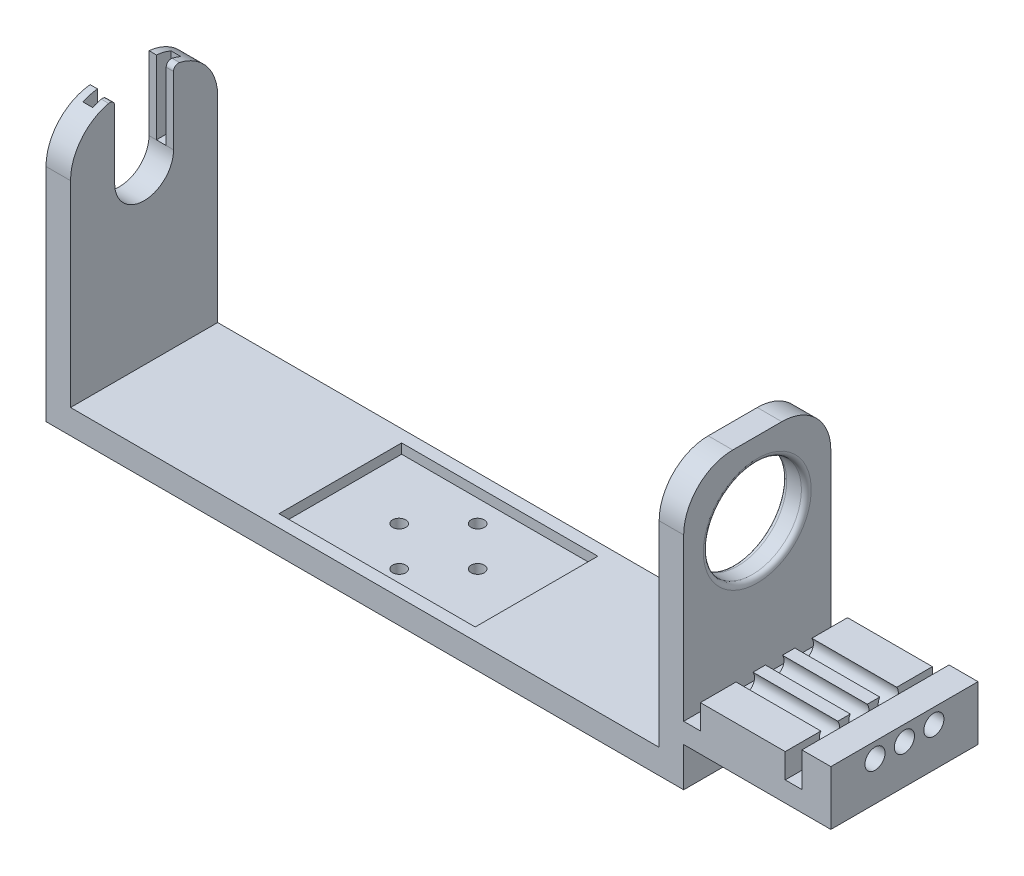
from build123d import *

# Parameters (mm, degrees)
SKETCH1_W           = 130
SKETCH1_H           = 30
BOSS_EXTRUDE1_DEPTH = 5
BOSS_EXTRUDE3_DEPTH = 1.8
SKETCH6_W           = 40
SKETCH6_H           = 25
CUT_EXTRUDE2_DEPTH  = 2
SKETCH5_R           = 1.35
CUT_EXTRUDE3_DEPTH  = 6
SKETCH8_W           = 5
SKETCH8_H           = 30
BOSS_EXTRUDE4_DEPTH = 50
SKETCH9_R           = 10
CUT_EXTRUDE4_DEPTH  = 5
SKETCH10_W          = 30
SKETCH10_H          = 11.1
BOSS_EXTRUDE5_DEPTH = 30
SKETCH11_W          = 3.4
SKETCH11_H          = 30
CUT_EXTRUDE5_DEPTH  = 7
CUT_EXTRUDE6_REACH  = 173.828
SKETCH12_R          = 2.05
CUT_EXTRUDE7_DEPTH  = 5
SKETCH14_W          = 17.3
SKETCH14_H          = 30
CUT_EXTRUDE8_DEPTH  = 2
SKETCH15_W          = 2
SKETCH15_H          = 3
CUT_EXTRUDE9_DEPTH  = 15
FILLET1_START       = -1
FILLET1_DEPTH       = 161
FILLET1_START_2     = 5
FILLET1_2_DEPTH     = 155
FILLET3_R           = 1
FILLET6_R           = 1


with BuildPart() as part:
    # Sketch1 → Boss-Extrude1 (new body)
    with BuildSketch(Plane(origin=(0, 0, 0), x_dir=(1, 0, 0), z_dir=(0, 1, 0))):
        with Locations((65, -15)):
            Rectangle(SKETCH1_W, SKETCH1_H)
    extrude(amount=BOSS_EXTRUDE1_DEPTH)

    # Sketch4 → Boss-Extrude3 (add)
    with BuildSketch(Plane.XZ):
        Polygon((63.1, 25), (66.9, 25), (66.9, 17), (66.9, 16.95), (67.95, 16.95), (74.95, 16.95), (74.95, 13.15), (66.95, 13.15), (66.9, 13.15), (66.9, 12.1), (66.9, 5.1), (63.1, 5.1), (63.1, 13.1), (63.1, 13.15), (62.05, 13.15), (55.05, 13.15), (55.05, 16.95), (63.05, 16.95), (63.1, 16.95), (63.1, 18), align=None)
    extrude(amount=BOSS_EXTRUDE3_DEPTH)

    # Sketch6 → Cut-Extrude2 (cut)
    with BuildSketch(Plane(origin=(0, 5, 0), x_dir=(1, 0, 0), z_dir=(0, 1, 0))):
        with Locations((65, -15)):
            Rectangle(SKETCH6_W, SKETCH6_H)
    extrude(amount=-CUT_EXTRUDE2_DEPTH, mode=Mode.SUBTRACT)

    # Sketch5 → Cut-Extrude3 (cut)
    with BuildSketch(Plane.XZ.offset(1.8)):
        with Locations(Location((65, 23, 0), (0, 0, 270))):
            Circle(SKETCH5_R)
        with Locations(Location((73, 15, 0), (0, 0, 270))):
            Circle(SKETCH5_R)
        with Locations(Location((57, 15, 0), (0, 0, 270))):
            Circle(SKETCH5_R)
        with Locations(Location((65, 7, 0), (0, 0, 270))):
            Circle(SKETCH5_R)
    extrude(amount=-CUT_EXTRUDE3_DEPTH, mode=Mode.SUBTRACT)

    # Sketch8 → Boss-Extrude4 (add)
    with BuildSketch(Plane(origin=(0, 5, 0), x_dir=(1, 0, 0), z_dir=(0, 1, 0))):
        with Locations((2.5, -15)):
            Rectangle(SKETCH8_W, SKETCH8_H)
        with Locations((127.5, -15)):
            Rectangle(SKETCH8_W, SKETCH8_H)
    extrude(amount=BOSS_EXTRUDE4_DEPTH)

    # Sketch9 → Cut-Extrude4 (cut)
    with BuildSketch(Plane(origin=(130, 0, 0), x_dir=(0, 0, -1), z_dir=(1, 0, 0))):
        with Locations((-15, 40)):
            Circle(SKETCH9_R)
    extrude(amount=-CUT_EXTRUDE4_DEPTH, mode=Mode.SUBTRACT)

    # Sketch10 → Boss-Extrude5 (add)
    with BuildSketch(Plane(origin=(130, 0, 0), x_dir=(0, 0, -1), z_dir=(1, 0, 0))):
        with Locations((-15, 13.55)):
            Rectangle(SKETCH10_W, SKETCH10_H)
    extrude(amount=BOSS_EXTRUDE5_DEPTH)

    # Sketch11 → Cut-Extrude5 (cut)
    with BuildSketch(Plane(origin=(0, 19.1, 0), x_dir=(1, 0, 0), z_dir=(0, 1, 0))):
        with Locations((131.7, -15)):
            Rectangle(SKETCH11_W, SKETCH11_H)
        with Locations((152.4, -15)):
            Rectangle(SKETCH11_W, SKETCH11_H)
    extrude(amount=-CUT_EXTRUDE5_DEPTH, mode=Mode.SUBTRACT)

    # Cut-Extrude6: up to this face of the body (flat: up to its plane)
    cut_extrude6_end = Plane(part.part.faces().sort_by_distance((130, 12.623489255, 15))[0])
    # Sketch12 → Cut-Extrude6 (cut, up to the picked face)
    with BuildSketch(Plane(origin=(160, 0, 0), x_dir=(0, 0, -1), z_dir=(1, 0, 0)), mode=Mode.PRIVATE) as cut_extrude6_sk1:
        with Locations((-15, 16)):
            Circle(SKETCH12_R)
    cut_extrude6_tool1 = split(extrude(cut_extrude6_sk1.sketch, amount=-CUT_EXTRUDE6_REACH, mode=Mode.PRIVATE), bisect_by=cut_extrude6_end, keep=Keep.BOTH, mode=Mode.PRIVATE)
    # Sketch12 → Cut-Extrude6 (cut, up to the picked face)
    with BuildSketch(Plane(origin=(160, 0, 0), x_dir=(0, 0, -1), z_dir=(1, 0, 0)), mode=Mode.PRIVATE) as cut_extrude6_sk2:
        with Locations((-21, 16)):
            Circle(SKETCH12_R)
    cut_extrude6_tool2 = split(extrude(cut_extrude6_sk2.sketch, amount=-CUT_EXTRUDE6_REACH, mode=Mode.PRIVATE), bisect_by=cut_extrude6_end, keep=Keep.BOTH, mode=Mode.PRIVATE)
    # Sketch12 → Cut-Extrude6 (cut, up to the picked face)
    with BuildSketch(Plane(origin=(160, 0, 0), x_dir=(0, 0, -1), z_dir=(1, 0, 0)), mode=Mode.PRIVATE) as cut_extrude6_sk3:
        with Locations((-9, 16)):
            Circle(SKETCH12_R)
    cut_extrude6_tool3 = split(extrude(cut_extrude6_sk3.sketch, amount=-CUT_EXTRUDE6_REACH, mode=Mode.PRIVATE), bisect_by=cut_extrude6_end, keep=Keep.BOTH, mode=Mode.PRIVATE)
    add(cut_extrude6_tool1.solids().sort_by(Axis((160, 16, 15), (-1, 0, 0)))[0], mode=Mode.SUBTRACT)
    add(cut_extrude6_tool2.solids().sort_by(Axis((160, 16, 21), (-1, 0, 0)))[0], mode=Mode.SUBTRACT)
    add(cut_extrude6_tool3.solids().sort_by(Axis((160, 16, 9), (-1, 0, 0)))[0], mode=Mode.SUBTRACT)

    # Sketch13 → Cut-Extrude7 (cut)
    with BuildSketch(Plane.ZY):
        with BuildLine():
            Line((9, 40), (9, 55))
            Line((9, 55), (21, 55))
            Line((21, 55), (21, 40))
            ThreePointArc((21, 40), (15, 34), (9, 40))
        make_face()
    extrude(amount=-CUT_EXTRUDE7_DEPTH, mode=Mode.SUBTRACT)

    # Sketch14 → Cut-Extrude8 (cut)
    with BuildSketch(Plane(origin=(0, 19.1, 0), x_dir=(1, 0, 0), z_dir=(0, 1, 0))):
        with Locations((142.05, -15)):
            Rectangle(SKETCH14_W, SKETCH14_H)
    extrude(amount=-CUT_EXTRUDE8_DEPTH, mode=Mode.SUBTRACT)

    # Sketch15 → Cut-Extrude9 (cut)
    with BuildSketch(Plane(origin=(0, 55, 0), x_dir=(1, 0, 0), z_dir=(0, 1, 0))):
        with Locations((2.5, -7.5)):
            Rectangle(SKETCH15_W, SKETCH15_H)
        with Locations((2.5, -22.5)):
            Rectangle(SKETCH15_W, SKETCH15_H)
    extrude(amount=-CUT_EXTRUDE9_DEPTH, mode=Mode.SUBTRACT)

    # Fillet1: read off the stored shape, not the designer's step
    # Fillet1 outline → Fillet1 (cut)
    with BuildSketch(Plane.YZ.offset(FILLET1_START)):
        with BuildLine():
            Line((55, 0), (55, 9))
            ThreePointArc((55, 9), (51.758329561, 2.583801513), (45.050125629, 0))
            Line((45.050125629, 0), (55, 0))
        make_face()
        with BuildLine():
            ThreePointArc((45.050125629, 30), (51.758329561, 27.416198487), (55, 21))
            Line((55, 21), (55, 30))
            Line((55, 30), (45.050125629, 30))
        make_face()
    extrude(amount=FILLET1_DEPTH, mode=Mode.SUBTRACT)

    # Fillet1 2 outline → Fillet1 2 (cut)
    with BuildSketch(Plane.YZ.offset(FILLET1_START_2)):
        with BuildLine():
            ThreePointArc((45, 30), (52.071067812, 27.071067812), (55, 20))
            Line((55, 20), (55, 21))
            ThreePointArc((55, 21), (51.758329561, 27.416198487), (45.050125629, 30))
            Line((45.050125629, 30), (45, 30))
        make_face()
        with BuildLine():
            ThreePointArc((45.050125629, 0), (51.758329561, 2.583801513), (55, 9))
            Line((55, 9), (55, 10))
            ThreePointArc((55, 10), (52.071067812, 2.928932188), (45, 0))
            Line((45, 0), (45.050125629, 0))
        make_face()
    extrude(amount=FILLET1_2_DEPTH, mode=Mode.SUBTRACT)

    # Fillet3
    fillet3_edges = [part.edges().sort_by_distance(p)[0] for p in [
        (4.25, 55, 9),
        (4.25, 55, 21),
    ]]
    fillet(fillet3_edges, radius=FILLET3_R)

    # Fillet6
    fillet6_edges = [part.edges().sort_by_distance(p)[0] for p in [
        (130, 40, 25),
        (125, 40, 25),
    ]]
    fillet(fillet6_edges, radius=FILLET6_R)


solid = part.part
